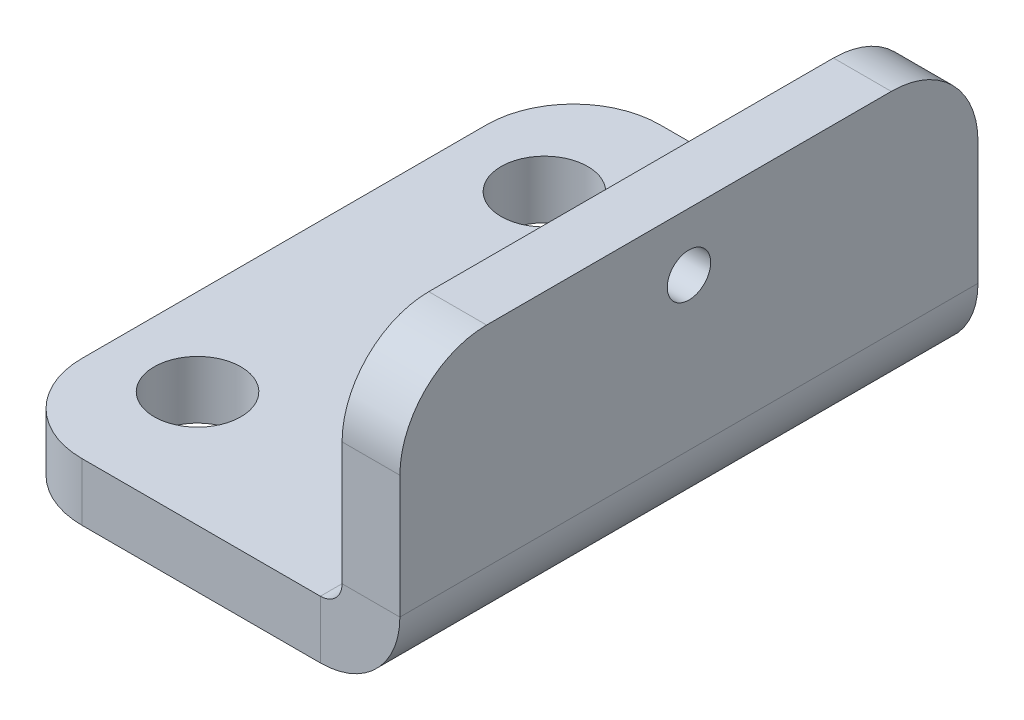
from build123d import *

# Parameters (mm, degrees)
BASE_FLANGE1_DEPTH = 10
FILLET1_R          = 3
SKETCH6_R          = 1.5
CUT_EXTRUDE1_DEPTH = 18.549928775
SKETCH7_R          = 0.75
CUT_EXTRUDE2_DEPTH = 18.549928775


# Sheet-metal steps are written as plain solids
with BuildPart() as part:
    # Sketch1 → Base-Flange1 (new, symmetric)
    with BuildSketch(Plane.XY):
        with BuildLine():
            Line((-12, 0), (-0.75, 0))
            ThreePointArc((-0.75, 0), (-0.219669914, 0.219669914), (0, 0.75))
            Line((0, 0.75), (0, 8))
            Line((0, 8), (2, 8))
            Line((2, 8), (2, 0.75))
            ThreePointArc((2, 0.75), (1.194543648, -1.194543648), (-0.75, -2))
            Line((-0.75, -2), (-12, -2))
            Line((-12, -2), (-12, 0))
        make_face()
    extrude(amount=BASE_FLANGE1_DEPTH, both=True)

    # Fillet1
    fillet1_edges = [part.edges().sort_by_distance(p)[0] for p in [
        (-12, -1, 10),
        (-12, -1, -10),
        (1, 8, 10),
        (1, 8, -10),
    ]]
    fillet(fillet1_edges, radius=FILLET1_R)

    # Sketch6 → Cut-Extrude1 (cut, through all)
    with BuildSketch(Plane(origin=(0, 0, 0), x_dir=(1, 0, 0), z_dir=(0, 1, 0))):
        with Locations(Location((-9, 6, 0), (0, 0, 270))):
            Circle(SKETCH6_R)
        with Locations(Location((-9, -6, 0), (0, 0, 90))):
            Circle(SKETCH6_R)
    extrude(amount=-CUT_EXTRUDE1_DEPTH, mode=Mode.SUBTRACT)

    # Sketch7 → Cut-Extrude2 (cut, through all)
    with BuildSketch(Plane.ZY):
        with Locations((0, 6)):
            Circle(SKETCH7_R)
    extrude(amount=-CUT_EXTRUDE2_DEPTH, mode=Mode.SUBTRACT)


solid = part.part
